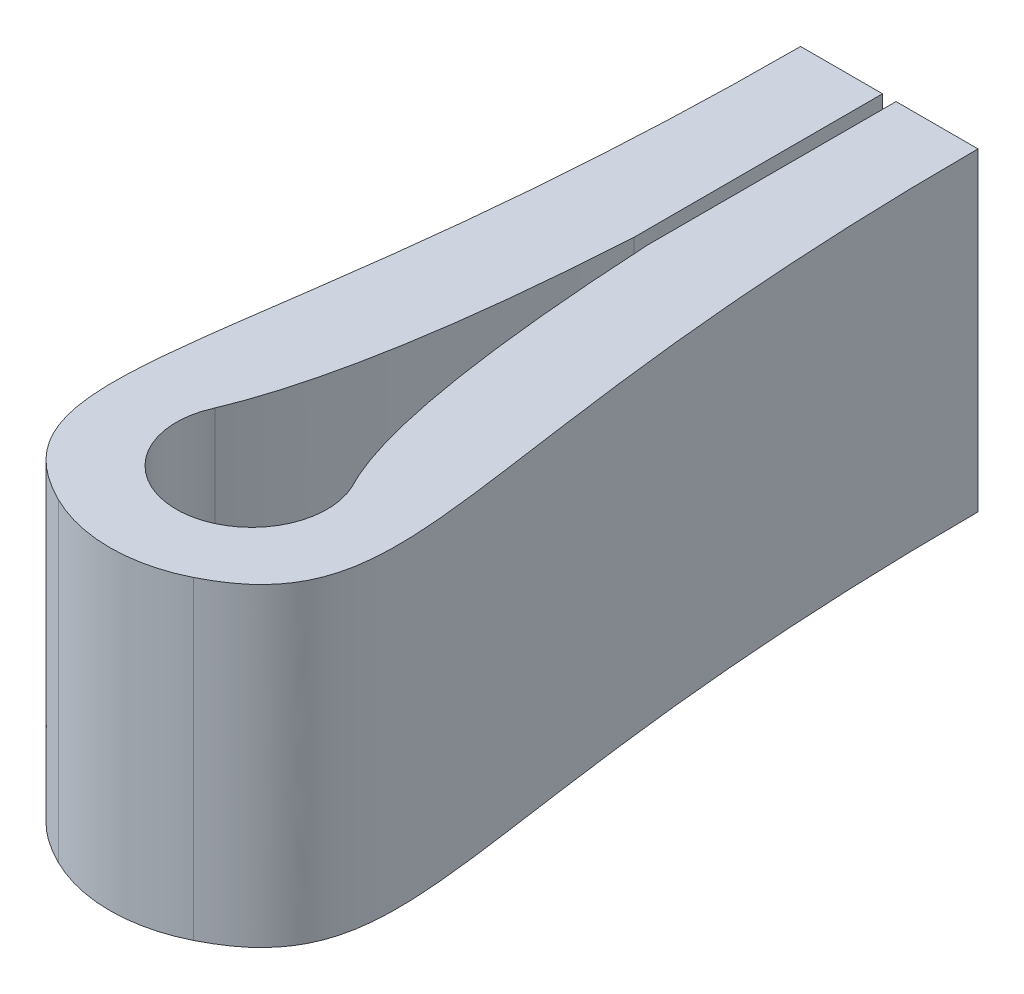
from build123d import *

# Parameters (mm, degrees)
BOSS_EXTRUDE1_DEPTH      = 1.5875
BOSS_EXTRUDE1_DEPTH_BACK = 1.5875
FILLET1_R                = 1.524


with BuildPart() as part:
    # Sketch1 → Boss-Extrude1 (new, two sides: drawn at the far end of the back side and taken through both)
    with BuildSketch(Plane(origin=(0, 0, 0), x_dir=(1, 0, 0), z_dir=(0, 1, 0)).offset(-BOSS_EXTRUDE1_DEPTH_BACK)):
        with BuildLine():
            Line((-0.068296764, 6.214618695), (-0.068296764, 8.723993601))
            Line((-0.068296764, 8.723993601), (-0.895808533, 8.723993601))
            add(Edge.make_bspline(
                [(-0.895808533, 8.723993601), (-0.895808533, 4.54222596), (-1.588668774, 2.219313027), (-2.088196173, 1.337696034), (0, 0.766240154)],
                knots=[0, 0, 0, 0, 0, 1, 1, 1, 1, 1], degree=4))
            add(Edge.make_bspline(
                [(0.895808533, 8.723993601), (0.895808533, 4.54222596), (1.588668774, 2.219313027), (2.088196173, 1.337696034), (0, 0.766240154)],
                knots=[0, 0, 0, 0, 0, 1, 1, 1, 1, 1], degree=4))
            Line((0.895808533, 8.723993601), (0.068296764, 8.723993601))
            Line((0.068296764, 8.723993601), (0.068296764, 6.214618695))
            add(Edge.make_bspline(
                [(0.690807422, 2.606475487), (0.218071276, 3.482132924), (0.068296764, 6.214618695)],
                knots=[0, 0, 0, 1, 1, 1], degree=2))
            ThreePointArc((0.690807422, 2.606475487), (0, 1.52287153), (-0.690807422, 2.606475487))
            add(Edge.make_bspline(
                [(-0.690807422, 2.606475487), (-0.217222133, 3.738734236), (-0.068296764, 6.214618695)],
                knots=[0, 0, 0, 1, 1, 1], degree=2))
        make_face()
    extrude(amount=BOSS_EXTRUDE1_DEPTH + BOSS_EXTRUDE1_DEPTH_BACK)

    # Fillet1
    fillet1_edges = [part.edges().sort_by_distance(p)[0] for p in [
        (0, -0.79375, -0.766240154),
    ]]
    fillet(fillet1_edges, radius=FILLET1_R)


solid = part.part
